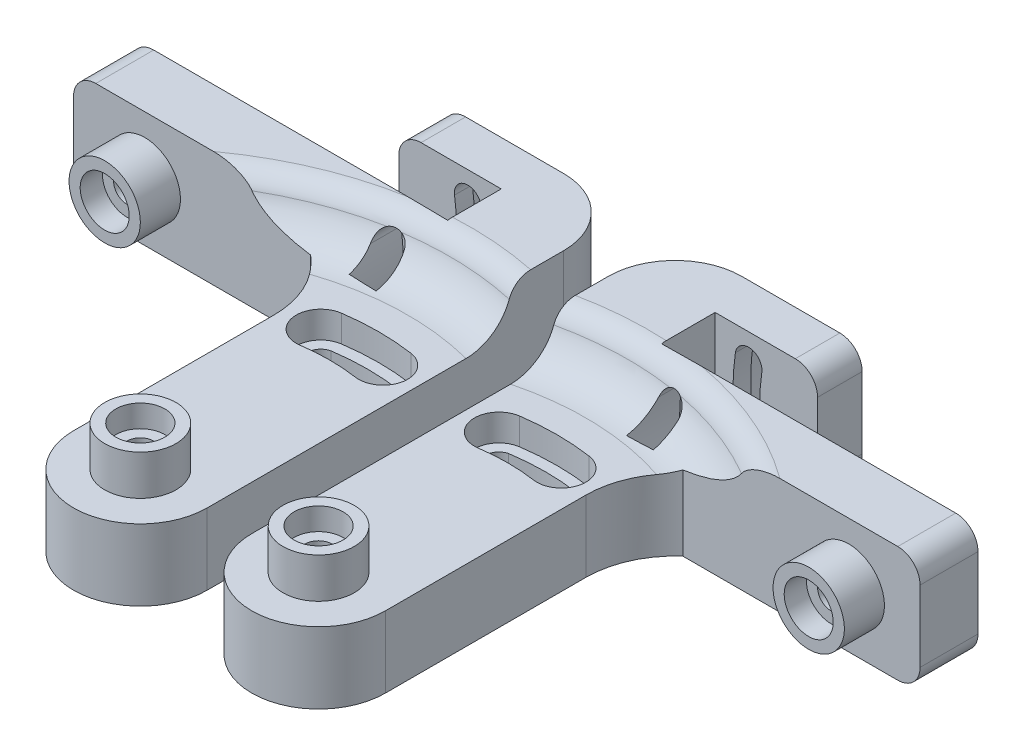
from build123d import *

# Parameters (mm, degrees)
SKETCH1_R           = 1.5
BOSS_EXTRUDE1_DEPTH = 8
SKETCH2_R           = 4
SKETCH2_R_2         = 1.5
BOSS_EXTRUDE2_DEPTH = 2
SKETCH4_R           = 4
SKETCH4_R_2         = 2.75
BOSS_EXTRUDE3_DEPTH = 2.5
CUT_EXTRUDE1_DEPTH  = 3
BOSS_EXTRUDE4_DEPTH = 5
BOSS_EXTRUDE5_DEPTH = 2.5
BOSS_EXTRUDE6_DEPTH = 13
BOSS_EXTRUDE7_DEPTH = 8
CUT_EXTRUDE4_START  = -5
SKETCH16_R          = 35.00000000000001
SKETCH16_R_2        = 33.50186054017001
CUT_EXTRUDE4_DEPTH  = 5
FILLET2_R           = 5
SKETCH6_R           = 1.5000000000000042
CUT_EXTRUDE5_DEPTH  = 17
SKETCH6_8_R         = 1.5000000000000042
CUT_EXTRUDE6_DEPTH  = 3
SKETCH17_R          = 3.999999999999999
SKETCH17_R_2        = 1.5000000000000042
BOSS_EXTRUDE8_DEPTH = 2
SKETCH18_R          = 4.000000000000003
SKETCH18_R_2        = 2.7500000000000018
BOSS_EXTRUDE9_DEPTH = 2.5
FILLET3_R           = 2.5
CUT_EXTRUDE7_START  = -10
SKETCH21_R          = 1.5000000000000042
CUT_EXTRUDE7_DEPTH  = 10


# Some blends are built 0.0001 mm under size
with BuildPart() as part:
    # Sketch1 → Boss-Extrude1 (new body)
    with BuildSketch(Plane(origin=(0, 0, 0), x_dir=(1, 0, 0), z_dir=(0, 1, 0))):
        with BuildLine():
            Line((-7.5, 36.50000000000001), (-37.5, 36.5))
            Line((-37.5, 36.5), (-37.5, 32.5))
            Line((-37.5, 32.5), (-17.500000000000068, 32.49999999999999))
            ThreePointArc((-17.500000000000068, 32.49999999999999), (-10.428932188134521, 29.571067811865472), (-7.499999999999997, 22.499999999999922))
            Line((-7.499999999999997, 22.499999999999922), (-7.5, 0))
            ThreePointArc((-7.5, 0), (-1.38e-15, -7.5), (7.5, 0))
            Line((7.5, 0), (7.5, 40))
            ThreePointArc((7.5, 40), (5.303300858899107, 45.30330085889911), (1.7e-16, 47.5))
            Line((1.7e-16, 47.5), (-13.500000000000002, 47.5))
            Line((-13.500000000000002, 47.5), (-13.500000000000002, 42.5))
            Line((-13.500000000000002, 42.5), (-2.0000000000000053, 42.5))
            Line((-2.0000000000000053, 42.5), (-2.0000000000000044, 36.50000000000001))
            Line((-2.0000000000000044, 36.50000000000001), (-7.5, 36.50000000000001))
        make_face()
        with Locations(Location((0, 0, 0), (0, 0, 270))):
            Circle(SKETCH1_R, mode=Mode.SUBTRACT)
        with BuildLine():
            ThreePointArc((-3.822328563123411, 25.208378945159915), (-4.975312131849936, 23.47239594738329), (-3.2806101420555054, 22.2595508442844))
            ThreePointArc((-3.2806101420555054, 22.2595508442844), (-0.0667184196164731, 22.499901229693076), (3.1485421826830366, 22.278615056087435))
            ThreePointArc((3.1485421826830366, 22.278615056087435), (4.959579589511544, 23.370856111085427), (3.8935926199376825, 25.19747013486111))
            ThreePointArc((3.8935926199376825, 25.19747013486111), (0.03604708010283943, 25.496495157085157), (-3.822328563123411, 25.208378945159915))
        make_face(mode=Mode.SUBTRACT)
    extrude(amount=BOSS_EXTRUDE1_DEPTH)

    # Sketch2 → Boss-Extrude2 (add)
    with BuildSketch(Plane(origin=(0, 8, 0), x_dir=(1, 0, 0), z_dir=(0, 1, 0))):
        with Locations(Location((0, 0, 0), (0, 0, 270))):
            Circle(SKETCH2_R)
        with Locations(Location((0, 0, 0), (0, 0, 270))):
            Circle(SKETCH2_R_2, mode=Mode.SUBTRACT)
    extrude(amount=BOSS_EXTRUDE2_DEPTH)

    # Sketch4 → Boss-Extrude3 (add)
    with BuildSketch(Plane(origin=(0, 10, 0), x_dir=(1, 0, 0), z_dir=(0, 1, 0))):
        with Locations(Location((0, 0, 0), (0, 0, 270))):
            Circle(SKETCH4_R)
        with Locations(Location((0, 0, 0), (0, 0, 270))):
            Circle(SKETCH4_R_2, mode=Mode.SUBTRACT)
    extrude(amount=BOSS_EXTRUDE3_DEPTH)

    # Sketch5 → Cut-Extrude1 (cut)
    with BuildSketch(Plane(origin=(0, 8, 0), x_dir=(1, 0, 0), z_dir=(0, 1, 0))):
        with BuildLine():
            ThreePointArc((-3.901041666666667, 26.46402036567631), (-6.220600224508779, 23.342378474500862), (-3.098958333333334, 21.022819916658754))
            ThreePointArc((-3.098958333333334, 21.022819916658754), (1.3e-15, 21.250000000000004), (3.098958333333334, 21.022819916658754))
            ThreePointArc((3.098958333333334, 21.022819916658754), (6.220600224508775, 23.342378474500865), (3.901041666666667, 26.46402036567631))
            ThreePointArc((3.901041666666667, 26.46402036567631), (1.64e-15, 26.749999999999996), (-3.901041666666667, 26.46402036567631))
        make_face()
    extrude(amount=-CUT_EXTRUDE1_DEPTH, mode=Mode.SUBTRACT)

    # Sketch11 → Boss-Extrude4 (add)
    with BuildSketch(Plane(origin=(0, 8, 0), x_dir=(1, 0, 0), z_dir=(0, 1, 0))):
        with BuildLine():
            Line((-13.500000000000002, 42.5), (-2.0000000000000053, 42.5))
            Line((-2.0000000000000053, 42.5), (-2.0000000000000044, 36.50000000000001))
            Line((-2.0000000000000044, 36.50000000000001), (-37.5, 36.5))
            Line((-37.5, 36.5), (-37.5, 32.5))
            Line((-37.5, 32.5), (-17.500000000000064, 32.49999999999999))
            ThreePointArc((-17.500000000000064, 32.49999999999999), (-15.859503936382302, 32.36452090398995), (-14.263458457505935, 31.961754533050943))
            ThreePointArc((-14.263458457505937, 31.961754533050936), (-3.5600570438609966, 34.81847202053036), (7.5, 34.18698582794336))
            Line((7.5, 34.18698582794336), (7.5, 40))
            ThreePointArc((7.5, 40), (5.303300858899107, 45.30330085889911), (1.3e-16, 47.5))
            Line((9.2e-16, 47.5), (-13.500000000000002, 47.5))
            Line((-13.500000000000002, 47.5), (-13.500000000000002, 42.5))
        make_face()
    extrude(amount=BOSS_EXTRUDE4_DEPTH)

    # Sketch12 → Boss-Extrude5 (add)
    with BuildSketch(Plane.XY.offset(-32.499999999999986)):
        Polygon((-37.500000000000014, 0), (-17.500000000000078, 0), (-17.500000000000085, 13.000000000000002), (-37.500000000000014, 13.000000000000002), align=None)
    extrude(amount=BOSS_EXTRUDE5_DEPTH)

    # Sketch14 → Boss-Extrude6 (add)
    with BuildSketch(Plane(origin=(0, 0, 0), x_dir=(1, 0, 0), z_dir=(0, 1, 0))):
        with BuildLine():
            Line((-17.500000000000068, 30.310889132455326), (-17.500000000000068, 32.49999999999999))
            ThreePointArc((-17.500000000000068, 32.49999999999999), (-15.859503936382302, 32.364520903989956), (-14.263458457505932, 31.961754533050946))
            ThreePointArc((-14.263458457505932, 31.961754533050946), (-15.903165170435354, 31.178347255136085), (-17.500000000000068, 30.310889132455326))
        make_face()
    extrude(amount=BOSS_EXTRUDE6_DEPTH)

    # Sketch15 → Boss-Extrude7 (add)
    with BuildSketch(Plane(origin=(0, 0, 0), x_dir=(1, 0, 0), z_dir=(0, 1, 0))):
        with BuildLine():
            Line((-17.500000000000075, 29.99999999999999), (-17.500000000000068, 30.310889132455326))
            ThreePointArc((-17.500000000000068, 30.310889132455326), (-15.90316517043534, 31.178347255136092), (-14.263458457505916, 31.961754533050954))
            ThreePointArc((-14.263458457505916, 31.961754533050954), (-12.477821634213894, 31.14741143130302), (-10.8856217223385, 29.99999999999999))
            Line((-10.8856217223385, 29.99999999999999), (-17.500000000000075, 29.99999999999999))
        make_face()
    extrude(amount=BOSS_EXTRUDE7_DEPTH)

    # Sketch16 → Cut-Extrude4 (cut)
    with BuildSketch(Plane(origin=(0, 13.000000000000002, 0), x_dir=(1, 0, 0), z_dir=(0, 1, 0)).offset(CUT_EXTRUDE4_START)):
        Circle(SKETCH16_R)
        Circle(SKETCH16_R_2, mode=Mode.SUBTRACT)
    extrude(amount=CUT_EXTRUDE4_DEPTH, mode=Mode.SUBTRACT)

    # Fillet2
    fillet2_edges = [part.edges().sort_by_distance(p)[0] for p in [
        (-5.664903014694961, 8.000000000000002, -34.538512907102714),
    ]]
    fillet(fillet2_edges, radius=FILLET2_R - 0.0001)  # a hair under: the kernel refuses the full size

    # Sketch6 → Cut-Extrude5 (cut)
    with BuildSketch(Plane(origin=(0, 0, -47.5), x_dir=(-1, 0, 0), z_dir=(0, 0, -1))):
        with BuildLine():
            ThreePointArc((7.240543617655439, 9.781249999999998), (5.9753298588324695, 11.483963758822968), (4.2726161000095, 10.21875))
            ThreePointArc((4.2726161000095, 10.21875), (4.0000000000000036, 6.5000000000000036), (4.2726161000095, 2.7812499999999973))
            ThreePointArc((4.2726161000095, 2.7812499999999973), (5.975329858832469, 1.5160362411770287), (7.240543617655439, 3.2187499999999973))
            ThreePointArc((7.240543617655439, 3.2187499999999973), (7, 6.500000000000003), (7.240543617655439, 9.781249999999998))
        make_face()
        with Locations((29.5, 6.5)):
            Circle(SKETCH6_R)
    extrude(amount=-CUT_EXTRUDE5_DEPTH, mode=Mode.SUBTRACT)

    # Sketch6<8> → Cut-Extrude6 (cut)
    # profile 1 of 2: a face of its own
    with BuildSketch(Plane(origin=(0, 0, -47.5), x_dir=(-1, 0, 0), z_dir=(0, 0, -1))):
        with Locations((29.5, 6.5)):
            Circle(SKETCH6_8_R)
    # profile 2 of 2: a face of its own
    with BuildSketch(Plane(origin=(0, 0, -47.5), x_dir=(-1, 0, 0), z_dir=(0, 0, -1))):
        with BuildLine():
            ThreePointArc((8.477180083341246, 9.598958333333332), (6.157621525499135, 12.720600224508775), (3.0359796343236902, 10.401041666666664))
            ThreePointArc((3.0359796343236902, 10.401041666666664), (2.7500000000000036, 6.5000000000000036), (3.0359796343236902, 2.5989583333333304))
            ThreePointArc((3.0359796343236902, 2.5989583333333304), (6.1576215254991356, 0.2793997754912185), (8.477180083341246, 3.401041666666664))
            ThreePointArc((8.477180083341246, 3.401041666666664), (8.249999999999996, 6.500000000000003), (8.477180083341246, 9.598958333333332))
        make_face()
        with BuildLine():
            ThreePointArc((7.240543617655439, 9.781249999999998), (5.9753298588324695, 11.483963758822968), (4.2726161000095, 10.21875))
            ThreePointArc((4.2726161000095, 10.21875), (4.0000000000000036, 6.5000000000000036), (4.2726161000095, 2.7812499999999973))
            ThreePointArc((4.2726161000095, 2.7812499999999973), (5.975329858832469, 1.5160362411770287), (7.240543617655439, 3.2187499999999973))
            ThreePointArc((7.240543617655439, 3.2187499999999973), (7, 6.500000000000003), (7.240543617655439, 9.781249999999998))
        make_face(mode=Mode.SUBTRACT)
    extrude(amount=-CUT_EXTRUDE6_DEPTH, mode=Mode.SUBTRACT)

    # Sketch17 → Boss-Extrude8 (add)
    with BuildSketch(Plane.XY.offset(-29.99999999999999)):
        with Locations((-29.5, 6.5)):
            Circle(SKETCH17_R)
        with Locations(Location((-29.5, 6.5, 0), (0, 0, 180))):
            Circle(SKETCH17_R_2, mode=Mode.SUBTRACT)
    extrude(amount=BOSS_EXTRUDE8_DEPTH)

    # Sketch18 → Boss-Extrude9 (add)
    with BuildSketch(Plane.XY.offset(-27.99999999999999)):
        with Locations((-29.5, 6.5)):
            Circle(SKETCH18_R)
        with Locations((-29.5, 6.5)):
            Circle(SKETCH18_R_2, mode=Mode.SUBTRACT)
    extrude(amount=BOSS_EXTRUDE9_DEPTH)

    # Fillet3
    # the kernel refuses this fillet: 2.5 mm, written as the material it takes off along each edge
    with BuildSketch(Plane(origin=(-13.500000000000002, 0, -53.75), x_dir=(1, 0, 0), z_dir=(0, 0, 1))) as fillet3_piece_1:
        with BuildLine():
            CenterArc((FILLET3_R, FILLET3_R), FILLET3_R, 180, 90)
            Line((0, FILLET3_R), (0, 0))
            Line((0, 0), (FILLET3_R, 0))
        make_face()
    extrude(amount=11.25, mode=Mode.SUBTRACT)
    with BuildSketch(Plane(origin=(-13.500000000000002, 13, -53.75), x_dir=(1, 0, 0), z_dir=(0, 0, 1))) as fillet3_piece_2:
        with BuildLine():
            CenterArc((FILLET3_R, -FILLET3_R), FILLET3_R, 90, 90)
            Line((0, -FILLET3_R), (0, 0))
            Line((0, 0), (FILLET3_R, 0))
        make_face()
    extrude(amount=11.25, mode=Mode.SUBTRACT)
    with BuildSketch(Plane(origin=(-37.5, 0, -23.749999999999986), x_dir=(1, 0, 0), z_dir=(0, 0, -1))) as fillet3_piece_3:
        with BuildLine():
            CenterArc((FILLET3_R, -FILLET3_R), FILLET3_R, 90, 90)
            Line((0, -FILLET3_R), (0, 0))
            Line((0, 0), (FILLET3_R, 0))
        make_face()
    extrude(amount=19.000000000000014, mode=Mode.SUBTRACT)
    with BuildSketch(Plane(origin=(-37.5, 13, -42.75), x_dir=(1, 0, 0), z_dir=(0, 2.7e-16, 1))) as fillet3_piece_4:
        with BuildLine():
            CenterArc((FILLET3_R, -FILLET3_R), FILLET3_R, 90, 90)
            Line((0, -FILLET3_R), (0, 0))
            Line((0, 0), (FILLET3_R, 0))
        make_face()
    extrude(amount=19.000000000000014, mode=Mode.SUBTRACT)
    with BuildSketch(Plane(origin=(0, 13.000000000000002, 0), x_dir=(-0.6358033115171895, 0, -0.7718511184572941), z_dir=(-0.7718511184572941, 0, 0.6358033115171895))) as fillet3_piece_5:
        with BuildLine():
            CenterArc((37.07109710083381, 2.500000000000002), FILLET3_R, 199.4706804383987, 70.52931956160131)
            Line((34.71406664014973, 1.6666888891851905), (34.47836359408132, 1.5833577781037094))
            ThreePointArc((34.47836359408132, 1.5833577781037094), (34.37037189508936, 9.999999998378e-05), (34.750000000000014, 1.78e-15))
            Line((34.750000000000014, 1.78e-15), (35.000000000000014, -0.24999999999999828))
            Line((35.000000000000014, -0.24999999999999828), (37.07109710083381, -0.24999999999999828))
            Line((37.07109710083381, -0.24999999999999828), (37.07109710083381, 1.78e-15))
        make_face()
    revolve(axis=Axis((0, 13.000000000000002, 0), (0, -1, 0)), revolution_arc=60.330086132550214, mode=Mode.SUBTRACT)

    # Sketch21 → Cut-Extrude7 (cut)
    with BuildSketch(Plane.XY.offset(-29.99999999999999).offset(CUT_EXTRUDE7_START)):
        with Locations((-29.5, 6.5)):
            Circle(SKETCH21_R)
    extrude(amount=CUT_EXTRUDE7_DEPTH, mode=Mode.SUBTRACT)


with BuildPart() as body_2:
    # Mirror4: mirrored copy
    add(part.part.mirror(Plane(origin=(10, 0, 0), x_dir=(0, 0, 1), z_dir=(1, 0, 0))))


solid = Compound([part.part, body_2.part])
